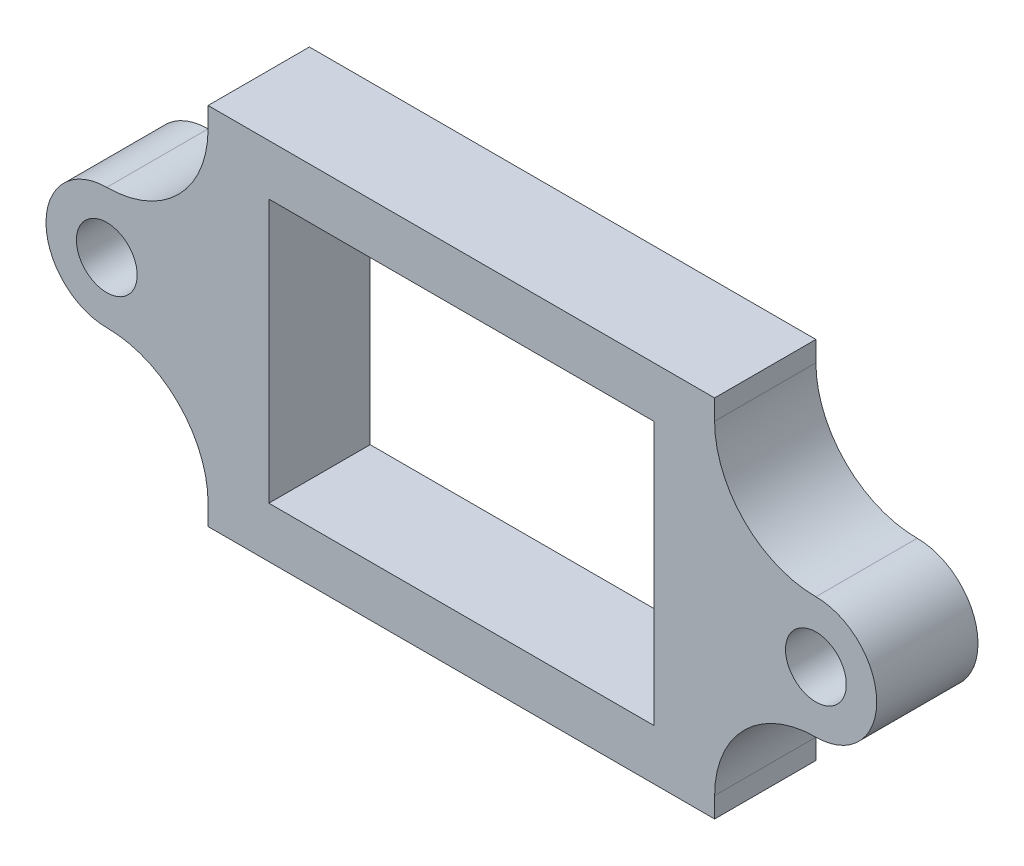
from build123d import *

# Parameters (mm, degrees)
SKETCH1_W           = 25
SKETCH1_H           = 18
SKETCH1_W_2         = 19
SKETCH1_H_2         = 13
BOSS_EXTRUDE1_DEPTH = 5
SKETCH2_R           = 1.5
BOSS_EXTRUDE2_DEPTH = 5
FILLET1_R           = 5


with BuildPart() as part:
    # Sketch1 → Boss-Extrude1 (new body)
    with BuildSketch(Plane.XY):
        Rectangle(SKETCH1_W, SKETCH1_H)
        Rectangle(SKETCH1_W_2, SKETCH1_H_2, mode=Mode.SUBTRACT)
    extrude(amount=BOSS_EXTRUDE1_DEPTH)

    # Sketch2 → Boss-Extrude2 (add)
    # profile 1 of 2: a face of its own
    with BuildSketch(Plane(origin=(0, 0, 0), x_dir=(-1, 0, 0), z_dir=(0, 0, -1))):
        with BuildLine():
            Line((-17.5, 3), (-12.5, 3))
            Line((-12.5, 3), (-12.5, -3))
            Line((-12.5, -3), (-17.5, -3))
            ThreePointArc((-17.5, -3), (-20.5, 0), (-17.5, 3))
        make_face()
        with Locations((-17.5, 0)):
            Circle(SKETCH2_R, mode=Mode.SUBTRACT)
    # profile 2 of 2: a face of its own
    with BuildSketch(Plane(origin=(0, 0, 0), x_dir=(-1, 0, 0), z_dir=(0, 0, -1))):
        with BuildLine():
            Line((17.5, 3), (12.5, 3))
            Line((12.5, 3), (12.5, -3))
            Line((12.5, -3), (17.5, -3))
            ThreePointArc((17.5, -3), (20.5, 0), (17.5, 3))
        make_face()
        with Locations(Location((17.5, 0, 0), (0, 0, 180))):
            Circle(SKETCH2_R, mode=Mode.SUBTRACT)
    extrude(amount=-BOSS_EXTRUDE2_DEPTH)

    # Fillet1
    fillet1_edges = [part.edges().sort_by_distance(p)[0] for p in [
        (12.5, -3, 2.5),
        (-12.5, -3, 2.5),
        (-12.5, 3, 2.5),
        (12.5, 3, 2.5),
    ]]
    fillet(fillet1_edges, radius=FILLET1_R - 0.0001)  # a hair under: the kernel refuses the full size


solid = part.part
